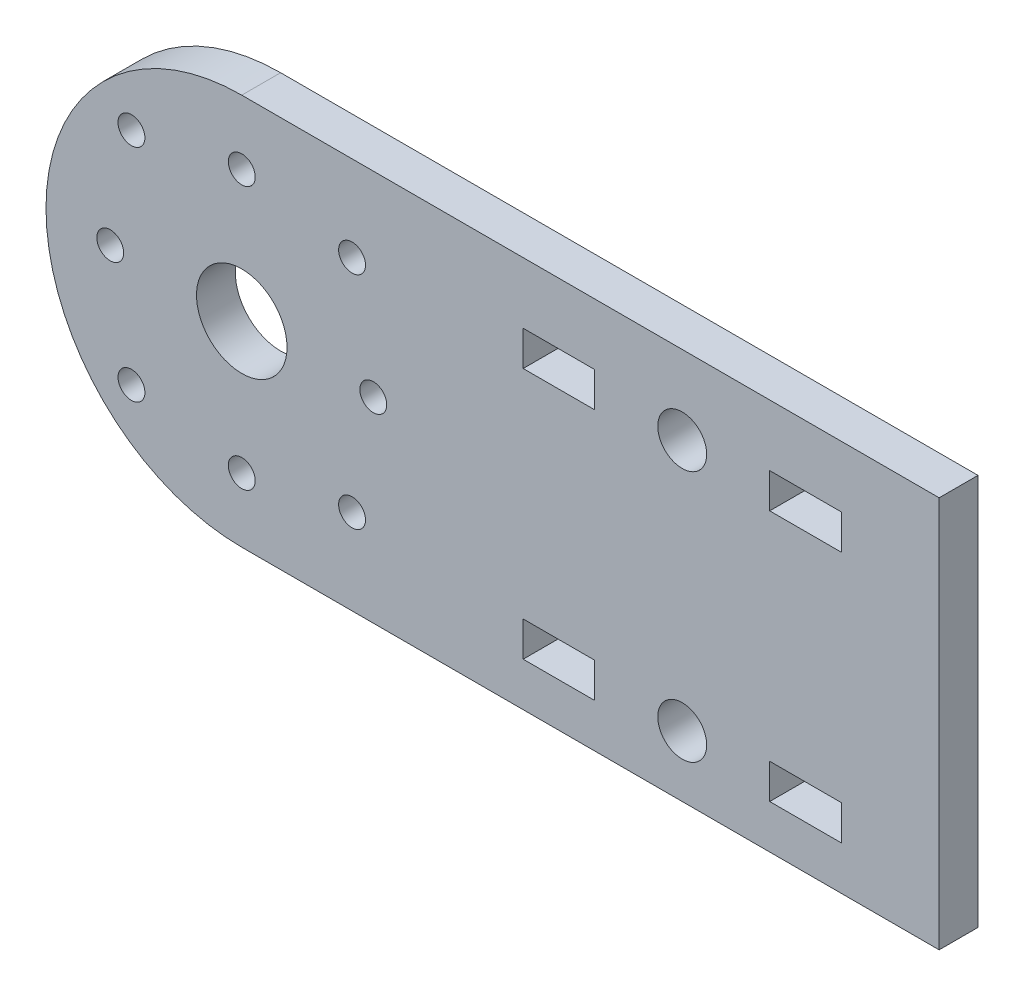
from build123d import *

# Parameters (mm, degrees)
SKETCH1_R           = 1.1
SKETCH1_R_2         = 3.7
SKETCH1_R_3         = 2
SKETCH1_W           = 5.85
SKETCH1_H           = 2.85
BOSS_EXTRUDE1_DEPTH = 3.175


with BuildPart() as part:
    # Sketch1 → Boss-Extrude1 (new body)
    with BuildSketch(Plane.XY):
        with BuildLine():
            Line((19, 0), (76, 0))
            Line((76, 0), (76, 32))
            Line((76, 32), (19, 32))
            ThreePointArc((19, 32), (3, 16), (19, 0))
        make_face()
        with Locations((8.25, 16)):
            Circle(SKETCH1_R, mode=Mode.SUBTRACT)
        with Locations((9.98438854, 25.01561146)):
            Circle(SKETCH1_R, mode=Mode.SUBTRACT)
        with Locations((28.01561146, 25.01561146)):
            Circle(SKETCH1_R, mode=Mode.SUBTRACT)
        with Locations((28.01561146, 6.98438854)):
            Circle(SKETCH1_R, mode=Mode.SUBTRACT)
        with Locations((9.98438854, 6.98438854)):
            Circle(SKETCH1_R, mode=Mode.SUBTRACT)
        with Locations((19, 26.75)):
            Circle(SKETCH1_R, mode=Mode.SUBTRACT)
        with Locations((29.75, 16)):
            Circle(SKETCH1_R, mode=Mode.SUBTRACT)
        with Locations((19, 5.25)):
            Circle(SKETCH1_R, mode=Mode.SUBTRACT)
        with Locations((19, 16)):
            Circle(SKETCH1_R_2, mode=Mode.SUBTRACT)
        with Locations((55, 5)):
            Circle(SKETCH1_R_3, mode=Mode.SUBTRACT)
        with Locations((55, 25.575)):
            Circle(SKETCH1_R_3, mode=Mode.SUBTRACT)
        with Locations((44.925, 25.575)):
            Rectangle(SKETCH1_W, SKETCH1_H, mode=Mode.SUBTRACT)
        with Locations((65.075, 25.575)):
            Rectangle(SKETCH1_W, SKETCH1_H, mode=Mode.SUBTRACT)
        with Locations((44.925, 5)):
            Rectangle(SKETCH1_W, SKETCH1_H, mode=Mode.SUBTRACT)
        with Locations((65.075, 5)):
            Rectangle(SKETCH1_W, SKETCH1_H, mode=Mode.SUBTRACT)
    extrude(amount=BOSS_EXTRUDE1_DEPTH)


solid = part.part
